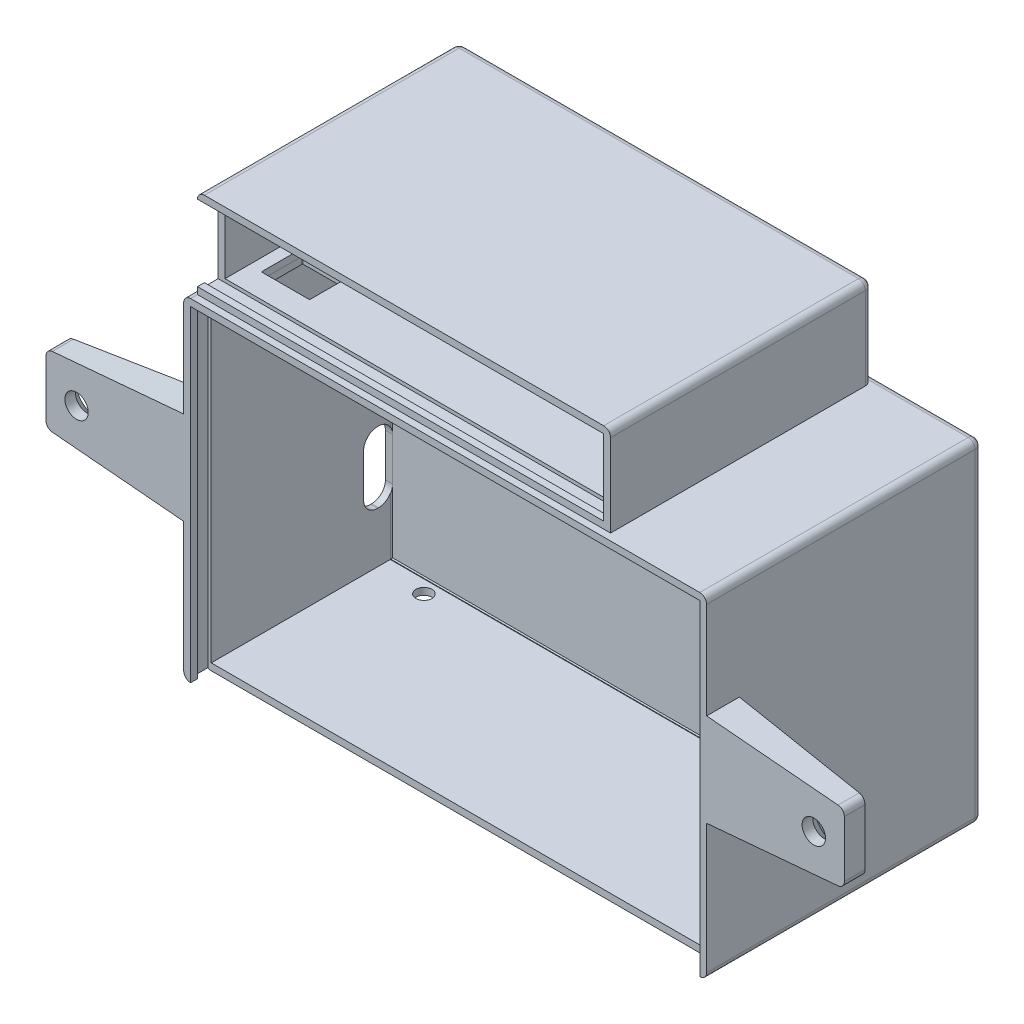
from build123d import *

# Parameters (mm, degrees)
ESQUISSE2_W                     = 75.950629162
ESQUISSE2_H                     = 48.325063529
BOSS_EXTRU_1_DEPTH              = 40
COQUE1_T                        = -1
CONG_6_R                        = 1
ESQUISSE3_W                     = 61
ESQUISSE3_H                     = 25.4
BOSS_EXTRU_2_DEPTH              = 10
COQUE3_START                    = -36.975314581
COQUE3_OUTLINE_W                = 25.4
COQUE3_OUTLINE_H                = 9
COQUE3_DEPTH                    = 60
ESQUISSE7_W                     = 60.919236105
ESQUISSE7_H                     = 25.234856741
ENL_V_MAT_EXTRU_3_DEPTH         = 0.3
ESQUISSE8_W                     = 5.603030018
ESQUISSE8_H                     = 3.307516655
ENL_V_MAT_EXTRU_4_DEPTH         = 61.439060764
ESQUISSE9_R                     = 1.45
BOSS_EXTRU_3_DEPTH              = 8
ESQUISSE11_W                    = 60
ESQUISSE11_H                    = 38
BOSS_EXTRU_4_DEPTH              = 13
COQUE7_T                        = -1
ESQUISSE12_W                    = 7
ESQUISSE12_H                    = 6
ENL_V_MAT_EXTRU_6_DEPTH         = 2
CONG_7_R                        = 0.1
CONG_9_R                        = 1
ESQUISSE14_W                    = 73.950629162
ESQUISSE14_H                    = 3
ENL_V_MAT_EXTRU_8_DEPTH         = 1
ESQUISSE18_W                    = 73.950629162
ESQUISSE18_H                    = 2
ENL_V_MAT_EXTRU_13_DEPTH        = 0.5
ESQUISSE19_W                    = 2
ESQUISSE19_H                    = 47.83
ENL_V_MAT_EXTRU_14_DEPTH        = 0.5
ESQUISSE20_W                    = 2
ESQUISSE20_H                    = 47.840534211
ENL_V_MAT_EXTRU_17_DEPTH        = 0.5
ESQUISSE21_W                    = 3
ESQUISSE21_H                    = 11
ENL_V_MAT_EXTRU_18_DEPTH        = 1
ESQUISSE25_W                    = 2
ESQUISSE25_H                    = 11
ENL_V_MAT_EXTRU_19_DEPTH        = 0.5
ESQUISSE26_W                    = 59.5
ESQUISSE26_H                    = 2
ENL_V_MAT_EXTRU_20_DEPTH        = 0.5
ESQUISSE28_W                    = 4.16014579
ESQUISSE28_H                    = 10.272040455
ENL_V_MAT_EXTRU_22_DEPTH        = 10
CONG_10_R                       = 2
ESQUISSE30_W                    = 3
ESQUISSE30_H                    = 10
BOSS_EXTRU_5_DEPTH              = 20
D_POUILLE4_ANGLE                = 5
CONG_11_R                       = 1
D_POUILLE4_OF_SYM_TRIE4_2_ANGLE = 5
CONG_11_OF_SYM_TRIE4_R          = 1
ESQUISSE43_W                    = 59.5
ESQUISSE43_H                    = 2
ENL_V_MAT_EXTRU_23_DEPTH        = 0.5
CONG_12_R                       = 0.1
ESQUISSE50_R                    = 1.160088801
ENL_V_MAT_EXTRU_26_DEPTH        = 1


# Read off the part's stored shape, not the designer's step: Coque3
with BuildPart() as part:
    # Esquisse2 → Boss.-Extru.1 (new body)
    with BuildSketch(Plane.XY):
        with Locations((0, -0.550937207)):
            Rectangle(ESQUISSE2_W, ESQUISSE2_H)
    extrude(amount=BOSS_EXTRU_1_DEPTH)

    # Coque1
    coque1_openings = [part.faces().sort_by_distance(p)[0] for p in [
        (0, -0.550937206, 40),
    ]]
    offset(amount=COQUE1_T, openings=coque1_openings, kind=Kind.INTERSECTION)

    # Congé6
    cong_6_edges = [part.edges().sort_by_distance(p)[0] for p in [
        (0, 23.611594558, 0),
        (37.975314581, -0.550937206, 0),
        (0, -24.713468971, 0),
        (-37.975314581, -0.550937206, 0),
        (-37.975314581, 23.611594558, 20),
        (37.975314581, 23.611594558, 20),
        (37.975314581, -24.713468971, 20),
        (-37.975314581, -24.713468971, 20),
    ]]
    fillet(cong_6_edges, radius=CONG_6_R)

    # Esquisse3 → Boss.-Extru.2 (add)
    with BuildSketch(Plane.XY.offset(1)):
        with Locations((-6.475314581, -11.013468971)):
            Rectangle(ESQUISSE3_W, ESQUISSE3_H)
    extrude(amount=BOSS_EXTRU_2_DEPTH)

    # Coque3 outline → Coque3 (cut)
    with BuildSketch(Plane.YZ.offset(COQUE3_START)):
        with Locations((-11.013468971, 5.5)):
            Rectangle(COQUE3_OUTLINE_W, COQUE3_OUTLINE_H)
    extrude(amount=COQUE3_DEPTH, mode=Mode.SUBTRACT)

    # Esquisse7 → Enlèv. mat.-Extru.3 (cut)
    with BuildSketch(Plane.XY.offset(11)):
        with Locations((-6.475314581, -11.01346897)):
            Rectangle(ESQUISSE7_W, ESQUISSE7_H)
    extrude(amount=-ENL_V_MAT_EXTRU_3_DEPTH, mode=Mode.SUBTRACT)

    # Esquisse8 → Enlèv. mat.-Extru.4 (cut, through all)
    with BuildSketch(Plane(origin=(0, 0, 0), x_dir=(-1, 0, 0), z_dir=(0, 0, -1))):
        with Locations((-0.620902428, 19.361594558)):
            Rectangle(ESQUISSE8_W, ESQUISSE8_H)
    extrude(amount=-ENL_V_MAT_EXTRU_4_DEPTH, mode=Mode.SUBTRACT)

    # Esquisse9 → Boss.-Extru.3 (add)
    with BuildSketch(Plane.XY.offset(1)):
        with Locations(Location((-9.379097572, 17.361594558, 0), (0, 0, 180))):
            Circle(ESQUISSE9_R)
    boss_extru_3 = extrude(amount=BOSS_EXTRU_3_DEPTH)

    # Symétrie2: Boss.-Extru.3 across plane
    add(boss_extru_3.mirror(Plane.ZY.offset(-0.620902428)))


with BuildPart() as body_2:
    # Esquisse11 → Boss.-Extru.4 (new body)
    with BuildSketch(Plane(origin=(0, 23.611594558, 0), x_dir=(1, 0, 0), z_dir=(0, 1, 0))):
        with Locations((-6.975314581, -20)):
            Rectangle(ESQUISSE11_W, ESQUISSE11_H)
    extrude(amount=BOSS_EXTRU_4_DEPTH)

    # Coque7
    coque7_openings = [body_2.faces().sort_by_distance(p)[0] for p in [
        (-6.975314581, 30.111594558, 39),
    ]]
    offset(amount=COQUE7_T, openings=coque7_openings, kind=Kind.INTERSECTION)


with BuildPart() as enl_v_mat_extru_6_tool:
    # Esquisse12 → Enlèv. mat.-Extru.6 (new body)
    with BuildSketch(Plane.XZ.offset(-22.611594558)):
        with Locations((-30.6900627, 29.504129392)):
            Rectangle(ESQUISSE12_W, ESQUISSE12_H)
    extrude(amount=-ENL_V_MAT_EXTRU_6_DEPTH)


with BuildPart() as part_1:
    add(part.part)

    # Enlèv. mat.-Extru.6: cut by enl_v_mat_extru_6_tool
    add(enl_v_mat_extru_6_tool.part, mode=Mode.SUBTRACT)

    # Congé7
    cong_7_edges = [part_1.edges().sort_by_distance(p)[0] for p in [
        (-27.1900627, 23.111594558, 26.504129392),
        (-34.1900627, 23.111594558, 26.504129392),
        (-34.1900627, 23.111594558, 32.504129392),
        (-27.1900627, 23.111594558, 32.504129392),
    ]]
    fillet(cong_7_edges, radius=CONG_7_R)

    # Esquisse14 → Enlèv. mat.-Extru.8 (cut)
    with BuildSketch(Plane(origin=(0, -24.713468971, 0), x_dir=(-1, 0, 0), z_dir=(0, -1, 0))):
        with Locations((0, -38.5)):
            Rectangle(ESQUISSE14_W, ESQUISSE14_H)
    extrude(amount=-ENL_V_MAT_EXTRU_8_DEPTH, mode=Mode.SUBTRACT)

    # Esquisse18 → Enlèv. mat.-Extru.13 (cut)
    with BuildSketch(Plane(origin=(0, 22.611594558, 0), x_dir=(-1, 0, 0), z_dir=(0, -1, 0))):
        with Locations((0, -38)):
            Rectangle(ESQUISSE18_W, ESQUISSE18_H)
    extrude(amount=-ENL_V_MAT_EXTRU_13_DEPTH, mode=Mode.SUBTRACT)

    # Esquisse19 → Enlèv. mat.-Extru.14 (cut)
    with BuildSketch(Plane(origin=(-36.975314581, 0, 0), x_dir=(0, 0, -1), z_dir=(1, 0, 0))):
        with Locations((-38, -0.803405442)):
            Rectangle(ESQUISSE19_W, ESQUISSE19_H)
    extrude(amount=-ENL_V_MAT_EXTRU_14_DEPTH, mode=Mode.SUBTRACT)

    # Esquisse20 → Enlèv. mat.-Extru.17 (cut)
    with BuildSketch(Plane.ZY.offset(-36.975314581)):
        with Locations((38, -0.793201866)):
            Rectangle(ESQUISSE20_W, ESQUISSE20_H)
    extrude(amount=-ENL_V_MAT_EXTRU_17_DEPTH, mode=Mode.SUBTRACT)

    # Esquisse28 → Enlèv. mat.-Extru.22 (cut)
    with BuildSketch(Plane.ZY.offset(37.975314581)):
        with Locations((12.784432773, -11.213387035)):
            Rectangle(ESQUISSE28_W, ESQUISSE28_H)
    extrude(amount=-ENL_V_MAT_EXTRU_22_DEPTH, mode=Mode.SUBTRACT)

    # Congé10
    # the kernel refuses this fillet: 2 mm, written as the material it adds along each edge
    with BuildSketch(Plane(origin=(-37.975314581, -16.349407262, 10.704359878), x_dir=(0, 0, 1), z_dir=(1, 0, 0))) as cong_10_piece_1_section:
        with BuildLine():
            CenterArc((CONG_10_R, -CONG_10_R), CONG_10_R, 90, 90)
            Line((0, -CONG_10_R), (0, 0))
            Line((0, 0), (CONG_10_R, 0))
        make_face()
    cong_10_piece_1 = extrude(amount=1.040381948, mode=Mode.PRIVATE)
    cong_10_piece_1 = split(cong_10_piece_1, bisect_by=Plane(origin=(-36.975314581, -16.116726214, 11.459351222), z_dir=(-1, 0, 0)), keep=Keep.TOP, mode=Mode.PRIVATE)
    cong_10_piece_1 = split(cong_10_piece_1, bisect_by=Plane(origin=(-37.475314581, -16.116726214, 11), z_dir=(0, 0, 1)), keep=Keep.TOP, mode=Mode.PRIVATE)
    add(cong_10_piece_1)
    with BuildSketch(Plane(origin=(-37.975314581, -16.349407262, 10.704359878), x_dir=(0, 0, 1), z_dir=(1, 0, 0))) as cong_10_piece_2_section:
        with BuildLine():
            CenterArc((CONG_10_R, -CONG_10_R), CONG_10_R, 90, 90)
            Line((0, -CONG_10_R), (0, 0))
            Line((0, 0), (CONG_10_R, 0))
        make_face()
    cong_10_piece_2 = extrude(amount=1.040381948, mode=Mode.PRIVATE)
    cong_10_piece_2 = split(cong_10_piece_2, bisect_by=Plane(origin=(-36.975314581, -15.644258666, 10.810672145), z_dir=(-1, 0, 0)), keep=Keep.TOP, mode=Mode.PRIVATE)
    cong_10_piece_2 = split(cong_10_piece_2, bisect_by=Plane(origin=(-37.475314581, -15.644258666, 11), z_dir=(0, 0, -1)), keep=Keep.TOP, mode=Mode.PRIVATE)
    add(cong_10_piece_2)
    with BuildSketch(Plane(origin=(-37.975314581, -16.349407262, 10.704359878), x_dir=(0, 0, 1), z_dir=(1, 0, 0))) as cong_10_piece_3_section:
        with BuildLine():
            CenterArc((CONG_10_R, -CONG_10_R), CONG_10_R, 90, 90)
            Line((0, -CONG_10_R), (0, 0))
            Line((0, 0), (CONG_10_R, 0))
        make_face()
    cong_10_piece_3 = extrude(amount=1.040381948, mode=Mode.PRIVATE)
    cong_10_piece_3 = split(cong_10_piece_3, bisect_by=Plane(origin=(-36.975314581, -15.644258666, 10.810672145), z_dir=(1, 0, 0)), keep=Keep.TOP, mode=Mode.PRIVATE)
    cong_10_piece_3 = split(cong_10_piece_3, bisect_by=Plane(origin=(-36.955123607, -15.644258666, 11), z_dir=(0, 0, -1)), keep=Keep.TOP, mode=Mode.PRIVATE)
    add(cong_10_piece_3)
    with BuildSketch(Plane(origin=(-37.975314581, -16.349407262, 14.864505668), x_dir=(0, 1, 0), z_dir=(1, 0, 0))) as cong_10_piece_4:
        with BuildLine():
            CenterArc((CONG_10_R, -CONG_10_R), CONG_10_R, 90, 90)
            Line((0, -CONG_10_R), (0, 0))
            Line((0, 0), (CONG_10_R, 0))
        make_face()
    extrude(amount=1)
    with BuildSketch(Plane(origin=(-37.975314581, -6.077366807, 10.704359878), x_dir=(0, -1, 0), z_dir=(1, 0, 0))) as cong_10_piece_5_section:
        with BuildLine():
            CenterArc((CONG_10_R, -CONG_10_R), CONG_10_R, 90, 90)
            Line((0, -CONG_10_R), (0, 0))
            Line((0, 0), (CONG_10_R, 0))
        make_face()
    cong_10_piece_5 = extrude(amount=1.040381948, mode=Mode.PRIVATE)
    cong_10_piece_5 = split(cong_10_piece_5, bisect_by=Plane(origin=(-36.975314581, -6.782515403, 10.810672145), z_dir=(-1, 0, 0)), keep=Keep.TOP, mode=Mode.PRIVATE)
    cong_10_piece_5 = split(cong_10_piece_5, bisect_by=Plane(origin=(-37.475314581, -6.782515403, 11), z_dir=(0, 0, -1)), keep=Keep.TOP, mode=Mode.PRIVATE)
    add(cong_10_piece_5)
    with BuildSketch(Plane(origin=(-37.975314581, -6.077366807, 10.704359878), x_dir=(0, -1, 0), z_dir=(1, 0, 0))) as cong_10_piece_6_section:
        with BuildLine():
            CenterArc((CONG_10_R, -CONG_10_R), CONG_10_R, 90, 90)
            Line((0, -CONG_10_R), (0, 0))
            Line((0, 0), (CONG_10_R, 0))
        make_face()
    cong_10_piece_6 = extrude(amount=1.040381948, mode=Mode.PRIVATE)
    cong_10_piece_6 = split(cong_10_piece_6, bisect_by=Plane(origin=(-36.975314581, -6.310047855, 11.459351222), z_dir=(-1, 0, 0)), keep=Keep.TOP, mode=Mode.PRIVATE)
    cong_10_piece_6 = split(cong_10_piece_6, bisect_by=Plane(origin=(-37.475314581, -6.310047855, 11), z_dir=(0, 0, 1)), keep=Keep.TOP, mode=Mode.PRIVATE)
    add(cong_10_piece_6)
    with BuildSketch(Plane(origin=(-37.975314581, -6.077366807, 10.704359878), x_dir=(0, -1, 0), z_dir=(1, 0, 0))) as cong_10_piece_7_section:
        with BuildLine():
            CenterArc((CONG_10_R, -CONG_10_R), CONG_10_R, 90, 90)
            Line((0, -CONG_10_R), (0, 0))
            Line((0, 0), (CONG_10_R, 0))
        make_face()
    cong_10_piece_7 = extrude(amount=1.040381948, mode=Mode.PRIVATE)
    cong_10_piece_7 = split(cong_10_piece_7, bisect_by=Plane(origin=(-36.975314581, -6.782515403, 10.810672145), z_dir=(1, 0, 0)), keep=Keep.TOP, mode=Mode.PRIVATE)
    cong_10_piece_7 = split(cong_10_piece_7, bisect_by=Plane(origin=(-36.955123607, -6.782515403, 11), z_dir=(0, 0, -1)), keep=Keep.TOP, mode=Mode.PRIVATE)
    add(cong_10_piece_7)
    with BuildSketch(Plane(origin=(-37.975314581, -6.077366807, 14.864505668), x_dir=(0, -1, 0), z_dir=(1, 0, 0))) as cong_10_piece_8:
        with BuildLine():
            CenterArc((CONG_10_R, CONG_10_R), CONG_10_R, 180, 90)
            Line((0, CONG_10_R), (0, 0))
            Line((0, 0), (CONG_10_R, 0))
        make_face()
    extrude(amount=1)

    # Esquisse30 → Boss.-Extru.5 (add)
    with BuildSketch(Plane.ZY.offset(37.975314581)):
        with Locations((38.5, 1.83823056)):
            Rectangle(ESQUISSE30_W, ESQUISSE30_H)
    boss_extru_5 = extrude(amount=BOSS_EXTRU_5_DEPTH)

    # Esquisse39 → Fraisage pour vis à tête fraisée M31 (revolve, cut)
    with BuildSketch(Plane(origin=(-53.540071982, 1.83823056, 37), x_dir=(0, 1, 0), z_dir=(1, 0, 0))):
        Polygon((0, 0), (0, 3), (1.7, 3), (1.7, 1.45), (3.15, 0), align=None)
    fraisage_pour_vis_t_te_frais_e_m31 = revolve(axis=Axis((-53.540071982, 1.83823056, 30.65), (0, 0, 1)), mode=Mode.SUBTRACT)

    # Dépouille4
    d_pouille4_faces = [part_1.faces().sort_by_distance(p)[0] for p in [
        (-47.975314581, 6.83823056, 38.5),
        (-46.947833329, 1.83823056, 37),
        (-47.975314581, -3.16176944, 38.5),
    ]]
    draft(d_pouille4_faces, Plane(origin=(-57.975314581, 0, 0), x_dir=(0, 0, -1), z_dir=(-1, 0, 0)), D_POUILLE4_ANGLE)

    # Congé11
    cong_11_edges = [part_1.edges().sort_by_distance(p)[0] for p in [
        (-57.975314581, -3.16176944, 38.5),
        (-57.975314581, 6.83823056, 38.5),
    ]]
    fillet(cong_11_edges, radius=CONG_11_R)

    # Symétrie4: Boss.-Extru.5, Fraisage pour vis à tête fraisée M31 across plane
    add(boss_extru_5.mirror(Plane.ZY))
    add(fraisage_pour_vis_t_te_frais_e_m31.mirror(Plane.ZY), mode=Mode.SUBTRACT)

    # Dépouille4 of Sym_trie4 2
    d_pouille4_of_sym_trie4_2_faces = [part_1.faces().sort_by_distance(p)[0] for p in [
        (47.975314581, 6.83823056, 38.5),
        (46.947833329, 1.83823056, 37),
        (47.975314581, -3.16176944, 38.5),
    ]]
    draft(d_pouille4_of_sym_trie4_2_faces, Plane(origin=(57.975314581, 0, 0), x_dir=(0, 0, -1), z_dir=(1, 0, 0)), D_POUILLE4_OF_SYM_TRIE4_2_ANGLE)

    # Congé11 of Symétrie4
    cong_11_of_sym_trie4_edges = [part_1.edges().sort_by_distance(p)[0] for p in [
        (57.975314581, -3.16176944, 38.5),
        (57.975314581, 6.83823056, 38.5),
    ]]
    fillet(cong_11_of_sym_trie4_edges, radius=CONG_11_OF_SYM_TRIE4_R)

    # Esquisse50 → Enlèv. mat.-Extru.26 (cut)
    with BuildSketch(Plane(origin=(0, -24.713468971, 0), x_dir=(-1, 0, 0), z_dir=(0, -1, 0))):
        with Locations(Location((30.206266219, -12.87943812, 0), (0, 0, 90))):
            Circle(ESQUISSE50_R)
    extrude(amount=-ENL_V_MAT_EXTRU_26_DEPTH, mode=Mode.SUBTRACT)


with BuildPart() as body_2_1:
    add(body_2.part)

    # Enlèv. mat.-Extru.6: cut by enl_v_mat_extru_6_tool
    add(enl_v_mat_extru_6_tool.part, mode=Mode.SUBTRACT)

    # Congé9
    cong_9_edges = [body_2_1.edges().sort_by_distance(p)[0] for p in [
        (23.024685419, 36.611594558, 20),
        (-6.975314581, 36.611594558, 1),
        (-36.975314581, 36.611594558, 20),
        (-36.975314581, 30.111594558, 1),
        (23.024685419, 30.111594558, 1),
    ]]
    fillet(cong_9_edges, radius=CONG_9_R)

    # Esquisse21 → Enlèv. mat.-Extru.18 (cut)
    with BuildSketch(Plane.ZY.offset(36.975314581)):
        with Locations((37.5, 30.111594558)):
            Rectangle(ESQUISSE21_W, ESQUISSE21_H)
    extrude(amount=-ENL_V_MAT_EXTRU_18_DEPTH, mode=Mode.SUBTRACT)

    # Esquisse25 → Enlèv. mat.-Extru.19 (cut)
    with BuildSketch(Plane.ZY.offset(-22.024685419)):
        with Locations((37, 30.111594558)):
            Rectangle(ESQUISSE25_W, ESQUISSE25_H)
    extrude(amount=-ENL_V_MAT_EXTRU_19_DEPTH, mode=Mode.SUBTRACT)

    # Esquisse26 → Enlèv. mat.-Extru.20 (cut)
    with BuildSketch(Plane(origin=(0, 35.611594558, 0), x_dir=(-1, 0, 0), z_dir=(0, -1, 0))):
        with Locations((7.225314581, -37)):
            Rectangle(ESQUISSE26_W, ESQUISSE26_H)
    extrude(amount=-ENL_V_MAT_EXTRU_20_DEPTH, mode=Mode.SUBTRACT)

    # Esquisse43 → Enlèv. mat.-Extru.23 (cut)
    with BuildSketch(Plane(origin=(0, 24.611594558, 0), x_dir=(1, 0, 0), z_dir=(0, 1, 0))):
        with Locations((-7.225314581, -37)):
            Rectangle(ESQUISSE43_W, ESQUISSE43_H)
    extrude(amount=-ENL_V_MAT_EXTRU_23_DEPTH, mode=Mode.SUBTRACT)

    # Congé12
    cong_12_edges = [body_2_1.edges().sort_by_distance(p)[0] for p in [
        (-27.1900627, 24.111594558, 26.504129392),
        (-34.1900627, 24.111594558, 26.504129392),
        (-34.1900627, 24.111594558, 32.504129392),
        (-27.1900627, 24.111594558, 32.504129392),
    ]]
    fillet(cong_12_edges, radius=CONG_12_R)


solid = Compound([part_1.part, body_2_1.part])
